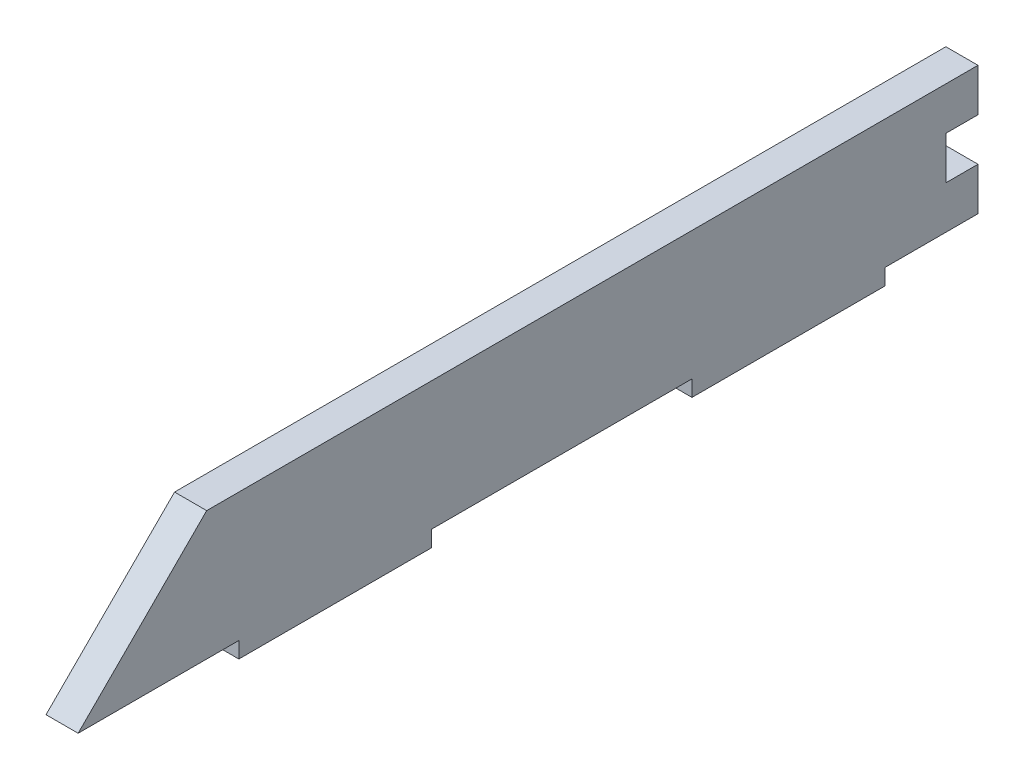
from build123d import *

# Parameters (mm, degrees)
SKETCH1_W               = 355.6
SKETCH1_H               = 50.8
BOSS_EXTRUDE1_DEPTH     = 12.7
CUT_EXTRUDE1_DEPTH      = 181.05357536
CUT_EXTRUDE1_DEPTH_BACK = 181.05357536
SKETCH3_W               = 76.2
SKETCH3_H               = 6.35
BOSS_EXTRUDE2_DEPTH     = 12.7
SKETCH4_W               = 12.7
SKETCH4_H               = 16.933333334
CUT_EXTRUDE2_DEPTH      = 182.058533353


with BuildPart() as part:
    # Sketch1 → Boss-Extrude1 (new body)
    with BuildSketch(Plane(origin=(0, 0, 0), x_dir=(0, 0, -1), z_dir=(1, 0, 0))):
        Rectangle(SKETCH1_W, SKETCH1_H)
    extrude(amount=BOSS_EXTRUDE1_DEPTH)

    # Sketch2 → Cut-Extrude1 (cut, two sides: drawn at the far end of the back side and taken through both)
    with BuildSketch(Plane(origin=(12.7, 0, 0), x_dir=(0, 0, -1), z_dir=(1, 0, 0)).offset(-CUT_EXTRUDE1_DEPTH_BACK)):
        Polygon((-692.871067812, -540.471067812), (-177.8, -25.4), (-127, 25.4), (388.071067812, 540.471067812), (-642.071067812, 1570.613203436), (-1723.013203436, 489.671067812), align=None)
    extrude(amount=CUT_EXTRUDE1_DEPTH + CUT_EXTRUDE1_DEPTH_BACK, mode=Mode.SUBTRACT)

    # Sketch3 → Boss-Extrude2 (add)
    with BuildSketch(Plane.ZY):
        with Locations((-102.87, -28.575)):
            Rectangle(SKETCH3_W, SKETCH3_H)
        with Locations((76.2, -28.575)):
            Rectangle(SKETCH3_W, SKETCH3_H)
    extrude(amount=-BOSS_EXTRUDE2_DEPTH)

    # Sketch4 → Cut-Extrude2 (cut, through all)
    with BuildSketch(Plane.ZY):
        with Locations((-171.45, 0)):
            Rectangle(SKETCH4_W, SKETCH4_H)
    extrude(amount=-CUT_EXTRUDE2_DEPTH, mode=Mode.SUBTRACT)


solid = part.part
